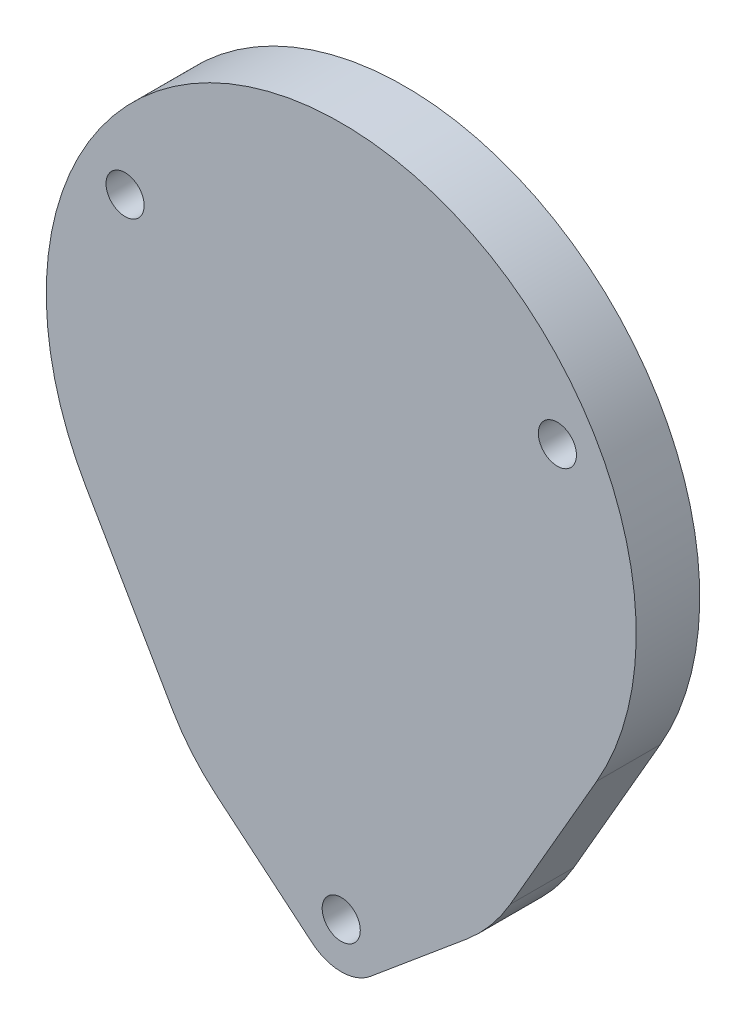
from build123d import *

# Parameters (mm, degrees)
SKETCH1_R           = 2.1
BOSS_EXTRUDE1_DEPTH = 7
BOSS_EXTRUDE2_START = 2
BOSS_EXTRUDE2_DEPTH = 2
SKETCH3_R           = 7.05
CUT_EXTRUDE1_DEPTH  = 5


with BuildPart() as part:
    # Sketch1 → Boss-Extrude1 (new body)
    with BuildSketch(Plane.XY):
        with BuildLine():
            Line((-28.145825623, -16.25), (-18.619546181, -32.75))
            ThreePointArc((-18.619546181, -32.75), (-16.454904015, -35.83785149), (-13.784048752, -38.5))
            Line((-13.784048752, -38.5), (-3.205592733, -47.337209302))
            ThreePointArc((-3.205592733, -47.337209302), (0, -48.5), (3.205592733, -47.337209302))
            Line((3.205592733, -47.337209302), (13.784048752, -38.5))
            ThreePointArc((13.784048752, -38.5), (16.454904015, -35.83785149), (18.619546181, -32.75))
            Line((18.619546181, -32.75), (28.145825623, -16.25))
            ThreePointArc((28.145825623, -16.25), (0, 32.5), (-28.145825623, -16.25))
        make_face()
        with Locations((0, -43.5)):
            Circle(SKETCH1_R, mode=Mode.SUBTRACT)
        with Locations((-23.815698604, 13.75)):
            Circle(SKETCH1_R, mode=Mode.SUBTRACT)
        with Locations((23.815698604, 13.75)):
            Circle(SKETCH1_R, mode=Mode.SUBTRACT)
    extrude(amount=BOSS_EXTRUDE1_DEPTH)

    # Sketch2 → Boss-Extrude2 (add)
    with BuildSketch(Plane(origin=(0, 0, 0), x_dir=(-1, 0, 0), z_dir=(0, 0, -1)).offset(BOSS_EXTRUDE2_START)):
        with BuildLine():
            ThreePointArc((-24.326965388, 11.713187226), (-26.981084283, -1.01049043), (-23.382685902, -13.5))
            Line((-23.382685902, -13.5), (-13.856406461, -30))
            ThreePointArc((-13.856406461, -30), (-2.795519193, -37.753890708), (10.257896746, -34.279069767))
            ThreePointArc((10.257896746, -34.279069767), (12.245509965, -32.297935992), (13.856406461, -30))
            Line((13.856406461, -30), (23.382685902, -13.5))
            ThreePointArc((23.382685902, -13.5), (26.981084283, -1.01049043), (24.326965388, 11.713187226))
            ThreePointArc((24.326965388, 11.713187226), (21.997045256, 12.7), (22.307400391, 15.21117641))
            ThreePointArc((22.307400391, 15.21117641), (0, 27), (-22.307400391, 15.21117641))
            ThreePointArc((-22.307400391, 15.21117641), (-21.869236911, 14.538217531), (-21.715698604, 13.75))
            ThreePointArc((-21.715698604, 13.75), (-22.524122096, 12.094152748), (-24.326965388, 11.713187226))
        make_face()
        with BuildLine():
            Line((-11.258330249, -28.5), (-20.784609691, -12))
            ThreePointArc((-20.784609691, -12), (0, 24), (20.784609691, -12))
            Line((20.784609691, -12), (11.258330249, -28.5))
            ThreePointArc((11.258330249, -28.5), (9.949476846, -30.367072994), (8.334541106, -31.976744186))
            ThreePointArc((8.334541106, -31.976744186), (-2.271359345, -34.8000362), (-11.258330249, -28.5))
        make_face(mode=Mode.SUBTRACT)
    extrude(amount=-BOSS_EXTRUDE2_DEPTH)

    # Sketch3 → Cut-Extrude1 (cut)
    with BuildSketch(Plane(origin=(0, 0, 0), x_dir=(-1, 0, 0), z_dir=(0, 0, -1))):
        with Locations((0, -22)):
            Circle(SKETCH3_R)
    extrude(amount=-CUT_EXTRUDE1_DEPTH, mode=Mode.SUBTRACT)


solid = part.part
